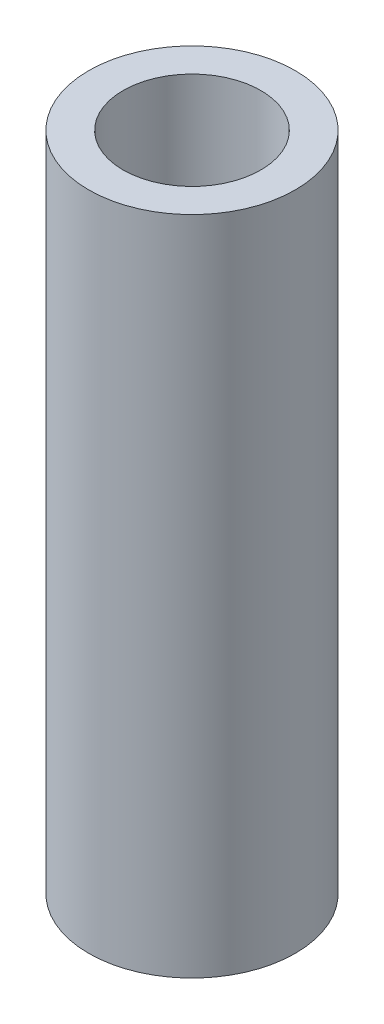
from build123d import *

# Parameters (mm, degrees)
EXTRUDE1_DEPTH          = 30.48
EXTRUDE1_DEPTH_BACK     = 30.48
SKETCH1_R               = 9.525
CUT_EXTRUDE1_DEPTH      = 34.323890079
CUT_EXTRUDE1_DEPTH_BACK = 34.323890079
SKETCH2_R               = 6.35


with BuildPart() as part:
    # Sketch1 → Extrude1 (new, two sides: drawn at the far end of the back side and taken through both)
    with BuildSketch(Plane(origin=(0, 0, 0), x_dir=(1, 0, 0), z_dir=(0, 1, 0)).offset(-EXTRUDE1_DEPTH_BACK)):
        Circle(SKETCH1_R)
    extrude(amount=EXTRUDE1_DEPTH + EXTRUDE1_DEPTH_BACK)

    # Sketch2 → Cut-Extrude1 (cut, two sides: drawn at the far end of the back side and taken through both)
    with BuildSketch(Plane(origin=(0, 0, 0), x_dir=(1, 0, 0), z_dir=(0, 1, 0)).offset(-CUT_EXTRUDE1_DEPTH_BACK)):
        Circle(SKETCH2_R)
    extrude(amount=CUT_EXTRUDE1_DEPTH + CUT_EXTRUDE1_DEPTH_BACK, mode=Mode.SUBTRACT)


solid = part.part
